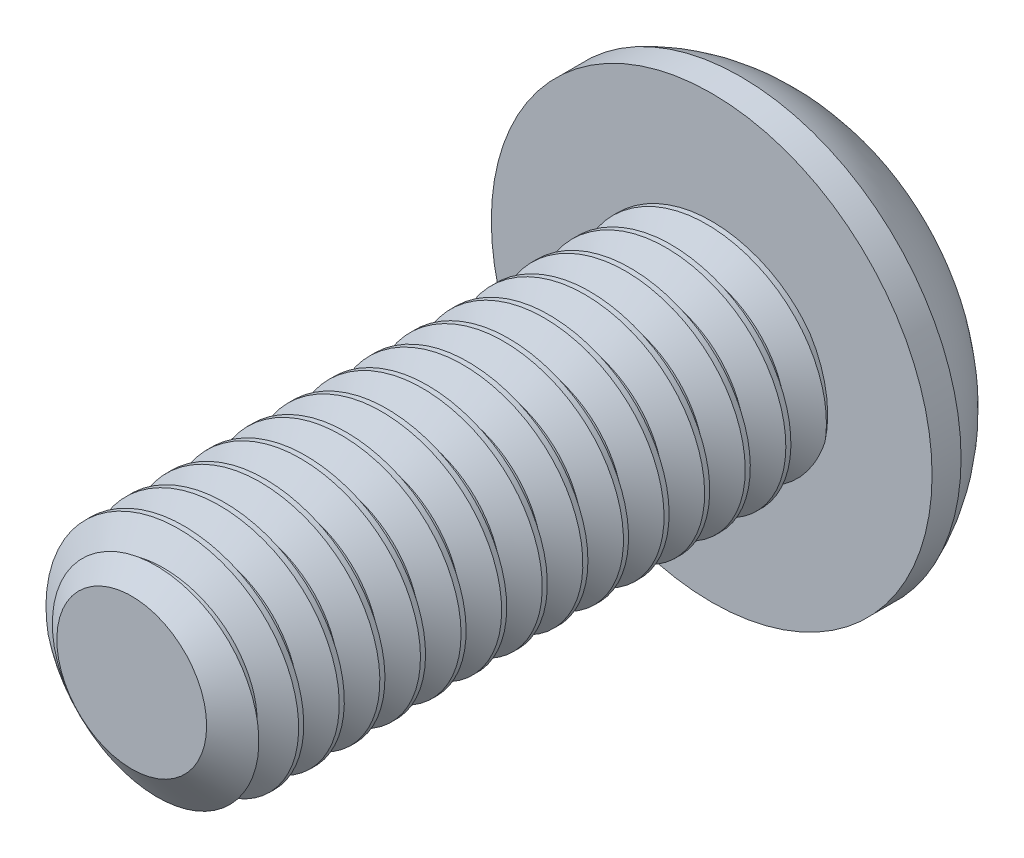
from build123d import *

# Parameters (mm, degrees)
SKETCH1_R          = 2
EXTRUDE1_DEPTH     = 10
CUT_SWEEP1_PITCH   = 0.7
SKETCH6_R          = 3.8
EXTRUDE2_DEPTH     = 2.2
CUT_EXTRUDE1_DEPTH = 1.875
SKETCH8_R          = 1.443375673
CUT_EXTRUDE2_DEPTH = 14.331166639
CUT_EXTRUDE2_TAPER = 45


with BuildPart() as part:
    # Sketch1 → Extrude1 (new body)
    with BuildSketch(Plane.XY):
        Circle(SKETCH1_R)
    extrude(amount=-EXTRUDE1_DEPTH)

    # Cut-Sweep1: the profile of Sketch3 profile screwed along a right-hand helix of 15.285714 turns, 6 arcs to a turn; built about Z, then put on its axis
    cut_sweep1_z = Axis((0, 0, 0), (0, 0, 1))
    cut_sweep1_corners = [(2.0003, 0, -0.612673205), (1.545336663, 0, -0.35), (1.545336663, 0, -0.2625), (2.0003, 0, 0.000173205)]
    with BuildLine(mode=Mode.PRIVATE) as cut_sweep1_profile:
        Line(cut_sweep1_corners[0], cut_sweep1_corners[1])
        Line(cut_sweep1_corners[1], cut_sweep1_corners[2])
        Line(cut_sweep1_corners[2], cut_sweep1_corners[3])
        Line(cut_sweep1_corners[3], cut_sweep1_corners[0])
    cut_sweep1_cap = Face(cut_sweep1_profile.wire())
    cut_sweep1_turn_angles = [0, 30, 60, 90, 120, 150, 180, 210, 240, 270, 300, 330, 360]
    cut_sweep1_turn_weights = [1, 0.8660254037844387, 1, 0.8660254037844387, 1, 0.8660254037844387, 1, 0.8660254037844387, 1, 0.8660254037844387, 1, 0.8660254037844387, 1]
    cut_sweep1_turn_rails = [Edge.make_bspline([Vector(p[0], p[1], 0).rotate(cut_sweep1_z, cut_sweep1_turn_angles[k]) / cut_sweep1_turn_weights[k] + Vector(0, 0, p[2] + CUT_SWEEP1_PITCH * cut_sweep1_turn_angles[k] / 360) for k in range(13)], [0, 0, 0, 1, 1, 2, 2, 3, 3, 4, 4, 5, 5, 6, 6, 6], 2, cut_sweep1_turn_weights) for p in cut_sweep1_corners]
    cut_sweep1_turn_sides = [Face.make_surface_from_curves(cut_sweep1_turn_rails[p[0]], cut_sweep1_turn_rails[p[1]]) for p in [(0, 1), (1, 2), (2, 3), (3, 0)]]
    cut_sweep1_last_angles = [5400, 5430, 5460, 5481.428571429, 5502.857142857]
    cut_sweep1_last_weights = [1, 0.8660254037844387, 1, 0.9308737486442353, 1]
    cut_sweep1_last_rails = [Edge.make_bspline([Vector(p[0], p[1], 0).rotate(cut_sweep1_z, cut_sweep1_last_angles[k]) / cut_sweep1_last_weights[k] + Vector(0, 0, p[2] + CUT_SWEEP1_PITCH * cut_sweep1_last_angles[k] / 360) for k in range(5)], [0, 0, 0, 1, 1, 2, 2, 2], 2, cut_sweep1_last_weights) for p in cut_sweep1_corners]
    cut_sweep1_last_sides = [Face.make_surface_from_curves(cut_sweep1_last_rails[p[0]], cut_sweep1_last_rails[p[1]]) for p in [(0, 1), (1, 2), (2, 3), (3, 0)]]
    cut_sweep1 = Plane(origin=(0, 0, 0), x_dir=(0, 1, 0), z_dir=(0, 0, -1)) * Solid(Shell([*[p.moved(Location((0, 0, CUT_SWEEP1_PITCH * i))) for i in range(15) for p in cut_sweep1_turn_sides], *cut_sweep1_last_sides, cut_sweep1_cap, cut_sweep1_cap.rotate(cut_sweep1_z, 5502.857142857).moved(Location((0, 0, CUT_SWEEP1_PITCH * 5502.857142857 / 360)))]))
    add(cut_sweep1, mode=Mode.SUBTRACT)

    # Sketch4 → Cut-Revolve1 (revolve, cut)
    with BuildSketch(Plane(origin=(0, 0, 0), x_dir=(0, 0, -1), z_dir=(1, 0, 0)), mode=Mode.PRIVATE) as cut_revolve1_sk:
        Polygon((0.496211411, 2), (0, 1.291336663), (0, 2), align=None)
    revolve(cut_revolve1_sk.sketch.rotate(Axis((0, 0, 0), (0, 0, -1)), 271.401126896), axis=Axis((0, 0, 0), (0, 0, -1)), mode=Mode.SUBTRACT)

    # Sketch6 → Extrude2 (add)
    with BuildSketch(Plane(origin=(0, 0, -10), x_dir=(-1, 0, 0), z_dir=(0, 0, -1))):
        Circle(SKETCH6_R)
    extrude(amount=EXTRUDE2_DEPTH)

    # Sketch10 → Cut-Revolve2 (revolve, cut)
    with BuildSketch(Plane(origin=(0, 0, 0), x_dir=(0, 0, -1), z_dir=(1, 0, 0)), mode=Mode.PRIVATE) as cut_revolve2_sk:
        with BuildLine():
            Line((10.5, 3.8), (10.5, 4.3))
            Line((10.5, 4.3), (12.7, 4.3))
            Line((12.7, 4.3), (12.7, 1.25))
            Line((12.7, 1.25), (12.2, 1.25))
            ThreePointArc((12.2, 1.25), (11.736038938, 2.782359292), (10.5, 3.8))
        make_face()
    revolve(cut_revolve2_sk.sketch.rotate(Axis((0, 0, 0), (0, 0, -1)), 90), axis=Axis((0, 0, 0), (0, 0, -1)), mode=Mode.SUBTRACT)

    # Sketch7 → Cut-Extrude1 (cut)
    with BuildSketch(Plane(origin=(0, 0, -12.2), x_dir=(-1, 0, 0), z_dir=(0, 0, -1))):
        Polygon((0, 1.443375673), (-1.25, 0.721687836), (-1.25, -0.721687836), (0, -1.443375673), (1.25, -0.721687836), (1.25, 0.721687836), align=None)
    extrude(amount=-CUT_EXTRUDE1_DEPTH, mode=Mode.SUBTRACT)

    # Sketch8 → Cut-Extrude2 (cut, through all)
    with BuildSketch(Plane.XY.offset(-12.2)):
        Circle(SKETCH8_R)
    extrude(amount=CUT_EXTRUDE2_DEPTH, taper=CUT_EXTRUDE2_TAPER, mode=Mode.SUBTRACT)


solid = part.part
